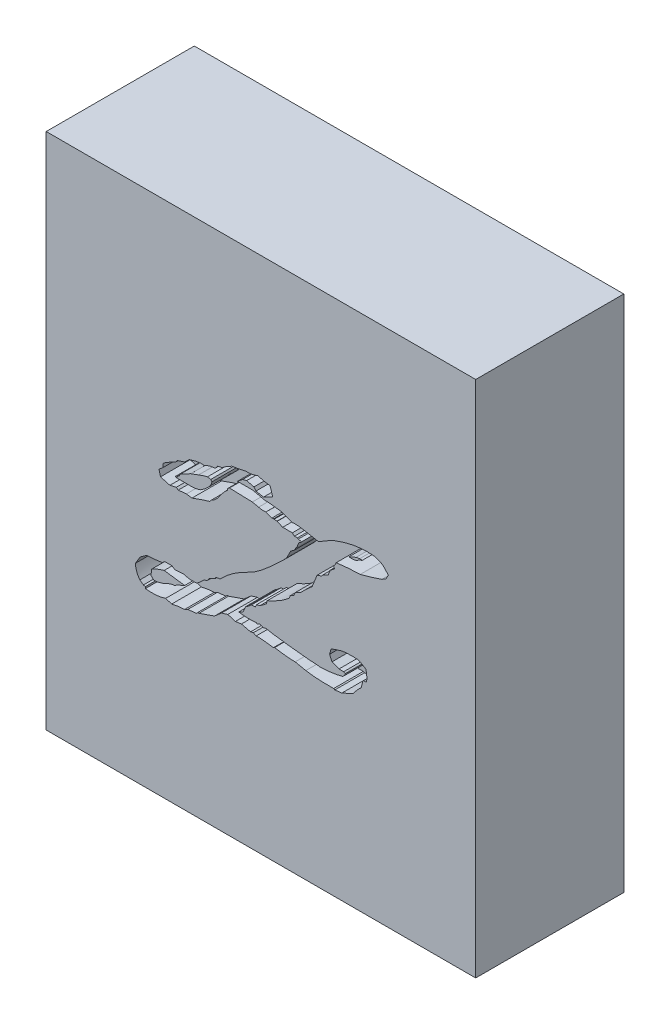
from build123d import *

# Parameters (mm, degrees)
SKETCH_1_W          = 29
SKETCH_1_H          = 35
EXTRUDE_1_DEPTH     = 10
CUT_EXTRUDE_START   = -2
CUT_EXTRUDE_1_DEPTH = 2


# Read off the part's stored shape, not the designer's step: 切除-拉伸1
with BuildPart() as part:
    # 草图1 → 凸台-拉伸1 (new body)
    with BuildSketch(Plane.XY):
        with Locations((14.5, 17.5)):
            Rectangle(SKETCH_1_W, SKETCH_1_H)
    extrude(amount=EXTRUDE_1_DEPTH)

    # 切除-拉伸1 outline → 切除-拉伸1 (cut)
    with BuildSketch(Plane.XY.offset(10).offset(CUT_EXTRUDE_START)):
        with BuildLine():
            add(Edge.make_bspline(
                [(22.917271104, 20.274238054), (22.869403472, 20.256124886), (22.781109189, 20.222714226), (22.702820752, 20.170084533), (22.666975403, 20.145987364)],
                knots=[0, 0, 0, 0, 0.542137381, 1, 1, 1, 1], degree=3))
            Line((22.917271104, 20.274238054), (23.107578579, 20.613481814))
            Line((23.107578579, 20.613481814), (22.702140915, 21.029262277))
            add(Edge.make_bspline(
                [(22.12708137, 21.244392466), (22.170055242, 21.235593963), (22.260707663, 21.217033717), (22.399373867, 21.169627039), (22.548723036, 21.107610593), (22.649390815, 21.056200998), (22.702140915, 21.029262277)],
                knots=[0, 0, 0, 0, 0.213330105, 0.450015082, 0.711806898, 1, 1, 1, 1], degree=3))
            add(Edge.make_bspline(
                [(21.696820991, 21.267146621), (21.768576367, 21.265935383), (21.912269177, 21.263509835), (22.05541685, 21.250770303), (22.12708137, 21.244392466)],
                knots=[0, 0, 0, 0, 0.499366504, 1, 1, 1, 1], degree=3))
            add(Edge.make_bspline(
                [(19.429679764, 20.793446492), (19.528573612, 20.831808457), (19.724062095, 20.907640498), (20.020061022, 21.00023724), (20.309550791, 21.085259447), (20.595732612, 21.150775708), (20.87728553, 21.202774088), (21.154002168, 21.240707471), (21.426908613, 21.261218535), (21.607153453, 21.265177252), (21.696820991, 21.267146621)],
                knots=[0, 0, 0, 0, 0.136558731, 0.269942569, 0.399229155, 0.525016684, 0.647800419, 0.767853589, 0.88451266, 1, 1, 1, 1], degree=3))
            add(Edge.make_bspline(
                [(19.102847361, 20.63003029), (19.151530386, 20.650560494), (19.263956265, 20.69797181), (19.369716292, 20.758901039), (19.429679764, 20.793446492)],
                knots=[0, 0, 0, 0, 0.433023297, 1, 1, 1, 1], degree=3))
            Line((19.102847361, 20.63003029), (18.38505721, 20.20804415))
            add(Edge.make_bspline(
                [(17.667267059, 20.344569078), (17.753995463, 20.325168911), (17.909232098, 20.290444225), (18.116416394, 20.254481651), (18.267745348, 20.221032582), (18.35188632, 20.211716735), (18.38505721, 20.20804415)],
                knots=[0, 0, 0, 0, 0.364678631, 0.65274444, 0.863101464, 1, 1, 1, 1], degree=3))
            add(Edge.make_bspline(
                [(16.819157658, 20.456271291), (16.877819297, 20.455059372), (17.003051108, 20.452472146), (17.203217012, 20.429484747), (17.427605186, 20.394849699), (17.584666673, 20.361898487), (17.667267059, 20.344569078)],
                knots=[0, 0, 0, 0, 0.205309663, 0.438298374, 0.704594855, 1, 1, 1, 1], degree=3))
            add(Edge.make_bspline(
                [(16.630918742, 20.441791375), (16.655697364, 20.445743476), (16.717997069, 20.455680057), (16.781132964, 20.456049055), (16.819157658, 20.456271291)],
                knots=[0, 0, 0, 0, 0.397732566, 1, 1, 1, 1], degree=3))
            add(Edge.make_bspline(
                [(15.863483163, 20.71690979), (15.878682961, 20.712878269), (15.914122344, 20.703478498), (15.974007159, 20.684418562), (16.048467738, 20.659561413), (16.137401009, 20.628458691), (16.24073269, 20.590963753), (16.358621798, 20.548562002), (16.488999799, 20.494799889), (16.581850777, 20.460118878), (16.630918742, 20.441791375)],
                knots=[0, 0, 0, 0, 0.057835421, 0.134847295, 0.231091253, 0.346595142, 0.48137487, 0.635440376, 0.807345066, 1, 1, 1, 1], degree=3))
            add(Edge.make_bspline(
                [(14.721638311, 20.826543444), (14.793363532, 20.822662575), (14.952801535, 20.814035789), (15.215048797, 20.793569381), (15.523820143, 20.759172027), (15.744920398, 20.731661845), (15.863483163, 20.71690979)],
                knots=[0, 0, 0, 0, 0.18780054, 0.417461844, 0.687619833, 1, 1, 1, 1], degree=3))
            add(Edge.make_bspline(
                [(13.943859934, 21.002371003), (13.99417614, 20.990567415), (14.10507327, 20.964552257), (14.285295955, 20.924309355), (14.493719464, 20.875193481), (14.642276729, 20.843483438), (14.721638311, 20.826543444)],
                knots=[0, 0, 0, 0, 0.194434276, 0.428533968, 0.69471403, 1, 1, 1, 1], degree=3))
            Line((13.943859934, 21.002371003), (12.913717297, 21.002371003))
            Line((12.913717297, 21.002371003), (13.265372414, 21.283695097))
            Line((13.265372414, 21.283695097), (13.532216591, 21.351957561))
            Line((13.532216591, 21.351957561), (14.026602315, 21.231981109))
            Line((14.026602315, 21.231981109), (14.161058683, 21.054084991))
            Line((14.161058683, 21.054084991), (14.669924324, 20.954794134))
            Line((14.669924324, 20.954794134), (15.296697856, 21.279557978))
            Line((15.296697856, 21.279557978), (15.114664619, 21.844274725))
            add(Edge.make_bspline(
                [(14.289309373, 22.013896605), (14.349167657, 21.996859839), (14.473702387, 21.961414969), (14.670994428, 21.915923423), (14.886538598, 21.877208344), (15.036677506, 21.855533405), (15.114664619, 21.844274725)],
                knots=[0, 0, 0, 0, 0.221332121, 0.460479885, 0.719755413, 1, 1, 1, 1], degree=3))
            add(Edge.make_bspline(
                [(13.503256758, 21.881508796), (13.559109968, 21.877922268), (13.677974781, 21.870289547), (13.866829264, 21.890936901), (14.073324595, 21.940739803), (14.214517217, 21.988563547), (14.289309373, 22.013896605)],
                knots=[0, 0, 0, 0, 0.208574048, 0.443879866, 0.705413618, 1, 1, 1, 1], degree=3))
            add(Edge.make_bspline(
                [(12.541376584, 21.699475559), (12.607668299, 21.707074534), (12.750448801, 21.723441368), (12.977051793, 21.764724851), (13.231898549, 21.81557373), (13.409632357, 21.858759784), (13.503256758, 21.881508796)],
                knots=[0, 0, 0, 0, 0.204278077, 0.439978457, 0.704998827, 1, 1, 1, 1], degree=3))
            add(Edge.make_bspline(
                [(11.852546266, 21.273352299), (11.961199944, 21.351895517), (12.180570008, 21.510473038), (12.420356166, 21.636081026), (12.541376584, 21.699475559)],
                knots=[0, 0, 0, 0, 0.495298563, 1, 1, 1, 1], degree=3))
            Line((11.852546266, 21.273352299), (11.583633529, 21.219569752))
            Line((11.583633529, 21.219569752), (11.397463173, 21.002371003))
            add(Edge.make_bspline(
                [(10.6858787, 20.809994968), (10.743820087, 20.83977569), (10.856902728, 20.897897921), (11.035714747, 20.958427423), (11.216032743, 20.994492171), (11.33731712, 20.999759089), (11.397463173, 21.002371003)],
                knots=[0, 0, 0, 0, 0.262118208, 0.511569038, 0.757782535, 1, 1, 1, 1], degree=3))
            add(Edge.make_bspline(
                [(9.66607886, 20.644510207), (9.769080306, 20.6770908), (9.960970882, 20.73778809), (10.235043739, 20.799958245), (10.47395976, 20.827337658), (10.61969034, 20.815411587), (10.6858787, 20.809994968)],
                knots=[0, 0, 0, 0, 0.311089015, 0.579555457, 0.80904121, 1, 1, 1, 1], degree=3))
            add(Edge.make_bspline(
                [(9.337177898, 20.342500518), (9.354328412, 20.35982698), (9.394813714, 20.40072762), (9.467022728, 20.468588379), (9.560752922, 20.550544651), (9.628905, 20.611345893), (9.66607886, 20.644510207)],
                knots=[0, 0, 0, 0, 0.163745096, 0.386534727, 0.665382579, 1, 1, 1, 1], degree=3))
            Line((9.337177898, 20.342500518), (8.85727209, 20.187358555))
            Line((8.85727209, 20.187358555), (8.726952841, 20.032216591))
            add(Edge.make_bspline(
                [(7.88298056, 19.533693748), (7.927142946, 19.569764822), (8.027798507, 19.651978545), (8.216181999, 19.767675708), (8.452467492, 19.89958284), (8.630577489, 19.985647168), (8.726952841, 20.032216591)],
                knots=[0, 0, 0, 0, 0.173899095, 0.396353376, 0.673366702, 1, 1, 1, 1], degree=3))
            Line((7.88298056, 19.533693748), (7.88298056, 19.285466607))
            Line((7.88298056, 19.285466607), (7.618204942, 19.066199298))
            Line((7.618204942, 19.066199298), (7.715427239, 18.662830193))
            Line((7.715427239, 18.662830193), (8.352543569, 18.487002634))
            Line((8.352543569, 18.487002634), (8.780735388, 18.584224932))
            Line((8.780735388, 18.584224932), (8.913123197, 18.487002634))
            Line((8.913123197, 18.487002634), (9.467497147, 18.542853741))
            Line((9.467497147, 18.542853741), (9.843974978, 18.487002634))
            add(Edge.make_bspline(
                [(11.054082294, 18.892440299), (10.970450883, 18.868957659), (10.790445965, 18.818414561), (10.506126906, 18.722828031), (10.185022742, 18.615065044), (9.961622542, 18.531178941), (9.843974978, 18.487002634)],
                knots=[0, 0, 0, 0, 0.20409704, 0.439290338, 0.704717698, 1, 1, 1, 1], degree=3))
            Line((11.054082294, 18.892440299), (11.140961793, 19.012416751))
            add(Edge.make_bspline(
                [(11.711884219, 19.52748807), (11.667165904, 19.466928085), (11.582129784, 19.351767527), (11.438319811, 19.207400159), (11.295040783, 19.090184137), (11.190961022, 19.037652569), (11.140961793, 19.012416751)],
                knots=[0, 0, 0, 0, 0.289993781, 0.551450695, 0.784519882, 1, 1, 1, 1], degree=3))
            add(Edge.make_bspline(
                [(12.251778252, 20.148055924), (12.213090865, 20.117176182), (12.125935439, 20.047609914), (11.999219045, 19.909481997), (11.856984623, 19.734027834), (11.762728258, 19.599860823), (11.711884219, 19.52748807)],
                knots=[0, 0, 0, 0, 0.179596998, 0.40459835, 0.678826736, 1, 1, 1, 1], degree=3))
            Line((12.251778252, 20.148055924), (12.251778252, 20.24941534))
            Line((12.251778252, 20.24941534), (12.371754704, 20.340431959))
            add(Edge.make_bspline(
                [(13.914900101, 20.29285509), (13.814913129, 20.295403067), (13.59629391, 20.300974162), (13.239217625, 20.31500132), (12.824754019, 20.32615412), (12.528961184, 20.335477053), (12.371754704, 20.340431959)],
                knots=[0, 0, 0, 0, 0.194350976, 0.424943948, 0.694372118, 1, 1, 1, 1], degree=3))
            add(Edge.make_bspline(
                [(14.338954801, 20.201838471), (14.28442406, 20.21398659), (14.188427796, 20.235372216), (14.064365759, 20.266349103), (13.977102748, 20.28266066), (13.931455579, 20.290141802), (13.914900101, 20.29285509)],
                knots=[0, 0, 0, 0, 0.386342293, 0.680119427, 0.883984573, 1, 1, 1, 1], degree=3))
            add(Edge.make_bspline(
                [(14.833340525, 20.168741519), (14.79755083, 20.163565847), (14.722099075, 20.152654508), (14.60262321, 20.157250827), (14.472975814, 20.170820556), (14.384985385, 20.191185121), (14.338954801, 20.201838471)],
                knots=[0, 0, 0, 0, 0.217023969, 0.457529438, 0.716216449, 1, 1, 1, 1], degree=3))
            Line((14.833340525, 20.168741519), (14.833340525, 20.1646044))
            Line((14.833340525, 20.1646044), (15.23670963, 20.013599555))
            Line((15.23670963, 20.013599555), (15.381508796, 20.059107865))
            Line((15.381508796, 20.059107865), (15.381508796, 20.013599555))
            Line((15.381508796, 20.013599555), (15.586296188, 20.013599555))
            Line((15.586296188, 20.013599555), (15.586296188, 19.99291396))
            Line((15.586296188, 19.99291396), (15.968979698, 19.841909116))
            Line((15.968979698, 19.841909116), (16.618507385, 19.841909116))
            Line((16.618507385, 19.841909116), (16.765375111, 19.717795545))
            Line((16.765375111, 19.717795545), (16.961888265, 19.717795545))
            Line((16.961888265, 19.717795545), (17.02394505, 19.680561474))
            Line((17.02394505, 19.680561474), (17.24507338, 19.627911869))
            add(Edge.make_bspline(
                [(17.042562086, 19.467499844), (17.087293918, 19.496971692), (17.159624743, 19.544627311), (17.221820541, 19.604492381), (17.24507338, 19.627911869)],
                knots=[0, 0, 0, 0, 0.522599733, 0.84503737, 0.84503737, 0.84503737, 0.84503737], degree=3))
            Line((17.042562086, 19.467499844), (16.910174277, 19.107570489))
            Line((16.910174277, 19.107570489), (16.866734527, 19.107570489))
            Line((16.866734527, 19.107570489), (16.76951223, 18.911057335))
            Line((16.76951223, 18.911057335), (16.510942291, 18.7186813))
            add(Edge.make_bspline(
                [(16.242029554, 18.205678541), (16.257042868, 18.236097654), (16.29171424, 18.306346794), (16.353615103, 18.421200062), (16.4263076, 18.56279613), (16.481060114, 18.663642543), (16.510942291, 18.7186813)],
                knots=[0, 0, 0, 0, 0.17567773, 0.405705753, 0.675653152, 1, 1, 1, 1], degree=3))
            add(Edge.make_bspline(
                [(14.007985279, 16.236409884), (14.042054146, 16.257363549), (14.115739281, 16.302682746), (14.228830487, 16.385785027), (14.359654038, 16.479110978), (14.502195159, 16.592951209), (14.661411849, 16.719604154), (14.832261225, 16.86559887), (15.019217913, 17.02464877), (15.214296977, 17.195753922), (15.405926461, 17.368280503), (15.585421, 17.529290767), (15.742318631, 17.678666993), (15.880132017, 17.813228777), (16.000988411, 17.929614032), (16.099246062, 18.034237457), (16.177389719, 18.124404736), (16.222187015, 18.180729859), (16.242029554, 18.205678541)],
                knots=[0, 0, 0, 0, 0.040175908, 0.086893621, 0.1409438, 0.201654134, 0.270152593, 0.345385065, 0.427454267, 0.516818802, 0.606124221, 0.686571581, 0.759110675, 0.823791511, 0.880137903, 0.927685787, 0.967969102, 1, 1, 1, 1], degree=3))
            add(Edge.make_bspline(
                [(13.161944438, 15.802012386), (13.21656604, 15.827912244), (13.336951167, 15.884995114), (13.530953709, 15.985901301), (13.759205064, 16.103133094), (13.921246551, 16.189942124), (14.007985279, 16.236409884)],
                knots=[0, 0, 0, 0, 0.190654024, 0.42019839, 0.689639639, 1, 1, 1, 1], degree=3))
            add(Edge.make_bspline(
                [(11.75118685, 14.711881522), (11.853621206, 14.815737842), (12.059583921, 15.024559668), (12.401652944, 15.306978493), (12.768380598, 15.569721682), (13.029698131, 15.723957482), (13.161944438, 15.802012386)],
                knots=[0, 0, 0, 0, 0.244431878, 0.491474294, 0.742647781, 1, 1, 1, 1], degree=3))
            Line((11.75118685, 14.711881522), (11.459519958, 14.653961856))
            Line((11.459519958, 14.653961856), (11.395394614, 14.546396761))
            Line((11.395394614, 14.546396761), (11.049945175, 14.401597595))
            Line((11.049945175, 14.401597595), (10.851363462, 14.159576132))
            Line((10.851363462, 14.159576132), (10.650713189, 14.107862144))
            add(Edge.make_bspline(
                [(10.156327465, 13.667258968), (10.196042589, 13.694979947), (10.279138256, 13.75298035), (10.40057565, 13.854933085), (10.525732939, 13.974296321), (10.607720765, 14.061916336), (10.650713189, 14.107862144)],
                knots=[0, 0, 0, 0, 0.218797591, 0.457788614, 0.71567752, 1, 1, 1, 1], degree=3))
            Line((10.156327465, 13.667258968), (9.643324706, 13.667258968))
            Line((9.643324706, 13.667258968), (9.293738148, 13.760344146))
            Line((9.293738148, 13.760344146), (8.68765021, 13.721041515))
            Line((8.68765021, 13.721041515), (8.491137057, 13.853429324))
            Line((8.491137057, 13.853429324), (8.002957011, 13.853429324))
            Line((8.002957011, 13.853429324), (7.845746488, 13.712767277))
            add(Edge.make_bspline(
                [(6.780438339, 13.601065063), (6.852873527, 13.604690885), (7.008989357, 13.612505432), (7.259305147, 13.636535966), (7.542102624, 13.66939058), (7.741002097, 13.697804137), (7.845746488, 13.712767277)],
                knots=[0, 0, 0, 0, 0.20301566, 0.437549192, 0.703802294, 1, 1, 1, 1], degree=3))
            Line((6.780438339, 13.601065063), (6.341903722, 13.292849696))
            Line((6.341903722, 13.292849696), (6.029551235, 12.769504139))
            add(Edge.make_bspline(
                [(6.323286686, 11.942080334), (6.278173008, 12.005516233), (6.190021386, 12.12946927), (6.099650856, 12.336231967), (6.039874248, 12.549634523), (6.033001628, 12.696014309), (6.029551235, 12.769504139)],
                knots=[0, 0, 0, 0, 0.260706566, 0.50941771, 0.753703636, 1, 1, 1, 1], degree=3))
            Line((6.323286686, 11.942080334), (6.56323959, 11.766252775))
            Line((6.56323959, 11.766252775), (6.69149028, 11.729018704))
            Line((6.69149028, 11.729018704), (6.69149028, 11.61524793))
            add(Edge.make_bspline(
                [(8.069150916, 11.735224382), (7.969794549, 11.704920567), (7.763664849, 11.642050753), (7.430665263, 11.59897162), (7.069703521, 11.58547016), (6.821051127, 11.605047248), (6.69149028, 11.61524793)],
                knots=[0, 0, 0, 0, 0.223339491, 0.463351306, 0.720378082, 1, 1, 1, 1], degree=3))
            Line((8.069150916, 11.735224382), (8.470451461, 11.602836573))
            add(Edge.make_bspline(
                [(9.347520695, 11.726950144), (9.262661266, 11.720612565), (9.100268508, 11.708484543), (8.868886189, 11.682389735), (8.661003373, 11.64776298), (8.531683096, 11.61727315), (8.470451461, 11.602836573)],
                knots=[0, 0, 0, 0, 0.287785405, 0.550725669, 0.787273873, 1, 1, 1, 1], degree=3))
            Line((9.347520695, 11.726950144), (9.558513766, 11.832446679))
            Line((9.558513766, 11.832446679), (10.164601703, 11.898640584))
            Line((10.164601703, 11.898640584), (10.224589929, 11.983451524))
            Line((10.224589929, 11.983451524), (10.313537988, 11.983451524))
            Line((10.313537988, 11.983451524), (11.364366221, 12.347517998))
            Line((11.364366221, 12.347517998), (11.83599779, 12.761229901))
            Line((11.83599779, 12.761229901), (12.26005249, 12.889480591))
            Line((12.26005249, 12.889480591), (12.777192369, 12.738475746))
            Line((12.777192369, 12.738475746), (13.180561474, 12.792258294))
            Line((13.180561474, 12.792258294), (13.796992209, 12.641253449))
            Line((13.796992209, 12.641253449), (13.987299684, 12.682624639))
            Line((13.987299684, 12.682624639), (14.17347004, 12.587470902))
            add(Edge.make_bspline(
                [(15.344274725, 12.490248605), (15.219553311, 12.508139527), (14.988396268, 12.541298329), (14.668577062, 12.577733534), (14.402528078, 12.595370221), (14.243807991, 12.589896584), (14.17347004, 12.587470902)],
                knots=[0, 0, 0, 0, 0.321201665, 0.595310983, 0.820659145, 1, 1, 1, 1], degree=3))
            Line((15.344274725, 12.490248605), (15.420811427, 12.531619795))
            add(Edge.make_bspline(
                [(16.81088342, 12.393026308), (16.717068155, 12.394062653), (16.514661973, 12.396298564), (16.188794088, 12.423180044), (15.819310654, 12.469807812), (15.558616607, 12.510244568), (15.420811427, 12.531619795)],
                knots=[0, 0, 0, 0, 0.201209934, 0.434109895, 0.700865483, 1, 1, 1, 1], degree=3))
            add(Edge.make_bspline(
                [(17.528673571, 12.242021463), (17.482500361, 12.253157531), (17.381362205, 12.27755006), (17.216020797, 12.314855106), (17.022915521, 12.354153437), (16.884710492, 12.379491234), (16.81088342, 12.393026308)],
                knots=[0, 0, 0, 0, 0.194226388, 0.425434986, 0.693075911, 1, 1, 1, 1], degree=3))
            add(Edge.make_bspline(
                [(19.408994169, 12.132387809), (19.23798441, 12.131231725), (18.905524398, 12.128984184), (18.421001375, 12.144817339), (17.964554065, 12.180784904), (17.67123948, 12.221992474), (17.528673571, 12.242021463)],
                knots=[0, 0, 0, 0, 0.272041597, 0.528875973, 0.771009597, 1, 1, 1, 1], degree=3))
            Line((19.408994169, 12.132387809), (19.49173655, 12.093085178))
            Line((19.49173655, 12.093085178), (19.959231, 12.140662047))
            Line((19.959231, 12.140662047), (20.734940817, 12.500591402))
            add(Edge.make_bspline(
                [(21.266560612, 13.094267983), (21.224302812, 13.061473752), (21.133437284, 12.99095742), (21.005952415, 12.854203782), (20.870191414, 12.689589), (20.781749827, 12.566001763), (20.734940817, 12.500591402)],
                knots=[0, 0, 0, 0, 0.200227712, 0.430542923, 0.698606474, 1, 1, 1, 1], degree=3))
            Line((21.266560612, 13.094267983), (21.378262826, 13.559693873))
            Line((21.378262826, 13.559693873), (21.436182492, 13.603133623))
            Line((21.436182492, 13.603133623), (21.634764206, 13.603133623))
            add(Edge.make_bspline(
                [(21.578913099, 14.360226405), (21.594108993, 14.304665165), (21.625457389, 14.190045008), (21.646261313, 14.006402452), (21.65029931, 13.809084092), (21.640066341, 13.673424572), (21.634764206, 13.603133623)],
                knots=[0, 0, 0, 0, 0.225911891, 0.466045329, 0.723335444, 1, 1, 1, 1], degree=3))
            Line((21.578913099, 14.360226405), (21.086595934, 14.641550499))
            add(Edge.make_bspline(
                [(19.944751083, 14.600179309), (20.017003103, 14.612400751), (20.175865056, 14.63927228), (20.439593945, 14.655039327), (20.74816145, 14.656303258), (20.968708553, 14.646689349), (21.086595934, 14.641550499)],
                knots=[0, 0, 0, 0, 0.191843468, 0.421810047, 0.690944481, 1, 1, 1, 1], degree=3))
            add(Edge.make_bspline(
                [(19.23523517, 14.360226405), (19.282028196, 14.379080044), (19.383244137, 14.419861522), (19.548284692, 14.480155003), (19.738971346, 14.538454265), (19.87371396, 14.578871236), (19.944751083, 14.600179309)],
                knots=[0, 0, 0, 0, 0.201952259, 0.43683406, 0.703095504, 1, 1, 1, 1], degree=3))
            Line((19.23523517, 14.360226405), (19.135944313, 14.00029705))
            Line((19.135944313, 14.00029705), (19.299360515, 13.638299135))
            Line((19.299360515, 13.638299135), (19.768923524, 13.456265898))
            Line((19.768923524, 13.456265898), (20.087481689, 13.456265898))
            Line((20.087481689, 13.456265898), (20.178498308, 13.40248335))
            Line((20.178498308, 13.40248335), (20.195046784, 13.385934874))
            Line((20.195046784, 13.385934874), (20.180566868, 13.292849696))
            Line((20.180566868, 13.292849696), (20.006807868, 13.141844851))
            add(Edge.make_bspline(
                [(18.55261053, 12.926714662), (18.696176482, 12.936244337), (18.968720296, 12.954335353), (19.354312061, 13.003197628), (19.69721934, 13.059388583), (19.907855446, 13.115489716), (20.006807868, 13.141844851)],
                knots=[0, 0, 0, 0, 0.293001141, 0.556229717, 0.791526034, 1, 1, 1, 1], degree=3))
            add(Edge.make_bspline(
                [(17.867917331, 12.974291531), (17.910676166, 12.975626166), (18.005226172, 12.978577364), (18.16187269, 12.967774416), (18.347420682, 12.95167391), (18.480942768, 12.935432313), (18.55261053, 12.926714662)],
                knots=[0, 0, 0, 0, 0.186681575, 0.412797595, 0.684820066, 1, 1, 1, 1], degree=3))
            add(Edge.make_bspline(
                [(14.791969335, 13.367317838), (14.861533197, 13.353111787), (15.016734594, 13.321417184), (15.276289613, 13.279108307), (15.585945993, 13.233790335), (15.946136715, 13.187355784), (16.35538045, 13.134189509), (16.815022023, 13.084607017), (17.324232929, 13.026882684), (17.681000789, 12.992372161), (17.867917331, 12.974291531)],
                knots=[0, 0, 0, 0, 0.068657918, 0.153180177, 0.254275256, 0.371313506, 0.504394769, 0.653367455, 0.818393515, 1, 1, 1, 1], degree=3))
            Line((14.791969335, 13.367317838), (14.674061443, 13.31974097))
            Line((14.674061443, 13.31974097), (14.403080146, 13.40455191))
            Line((14.403080146, 13.40455191), (14.204498433, 13.31974097))
            Line((14.204498433, 13.31974097), (14.181744278, 13.367317838))
            add(Edge.make_bspline(
                [(13.002689596, 13.408952641), (13.054178119, 13.397775975), (13.202168875, 13.368367332), (13.46714714, 13.352411276), (13.808899715, 13.343510316), (14.052140379, 13.359042144), (14.181744278, 13.367317838)],
                knots=[0.072992971, 0.072992971, 0.072992971, 0.072992971, 0.19670595, 0.427617966, 0.695022441, 1, 1, 1, 1], degree=3))
            Line((13.002689596, 13.408952641), (13.286058009, 13.551419635))
            Line((13.286058009, 13.551419635), (13.478434044, 13.963062978))
            Line((13.478434044, 13.963062978), (13.552902186, 13.987885693))
            Line((13.552902186, 13.987885693), (13.865254673, 14.25266131))
            Line((13.865254673, 14.25266131), (14.119687493, 14.25266131))
            Line((14.119687493, 14.25266131), (14.208635552, 14.438831666))
            Line((14.208635552, 14.438831666), (14.423765741, 14.482271416))
            Line((14.423765741, 14.482271416), (14.85609468, 14.800829581))
            Line((14.85609468, 14.800829581), (14.924357144, 15.024234009))
            add(Edge.make_bspline(
                [(16.403377196, 15.901303243), (16.303363476, 15.82152523), (16.095618827, 15.655813413), (15.743822695, 15.43456586), (15.351757758, 15.21899711), (15.070080546, 15.090639018), (14.924357144, 15.024234009)],
                knots=[0, 0, 0, 0, 0.222344532, 0.461845505, 0.721590172, 1, 1, 1, 1], degree=3))
            Line((16.403377196, 15.901303243), (16.47163966, 16.089542158))
            Line((16.47163966, 16.089542158), (16.728141039, 16.236409884))
            Line((16.728141039, 16.236409884), (16.800540622, 16.430854478))
            Line((16.800540622, 16.430854478), (17.19356693, 16.648053227))
            add(Edge.make_bspline(
                [(17.954796831, 17.363774819), (17.901188647, 17.32023714), (17.785056238, 17.225920654), (17.608011441, 17.059013104), (17.405038081, 16.866894232), (17.266764561, 16.723801824), (17.19356693, 16.648053227)],
                knots=[0, 0, 0, 0, 0.198095335, 0.429137623, 0.697803503, 1, 1, 1, 1], degree=3))
            add(Edge.make_bspline(
                [(18.291972032, 18.199472862), (18.267888076, 18.13946472), (18.21719221, 18.013149724), (18.136084594, 17.814054099), (18.047236635, 17.595713407), (17.986415866, 17.443109413), (17.954796831, 17.363774819)],
                knots=[0, 0, 0, 0, 0.215258938, 0.453112379, 0.715688257, 1, 1, 1, 1], degree=3))
            Line((18.291972032, 18.199472862), (18.593981721, 18.298763719))
            Line((18.593981721, 18.298763719), (18.674655542, 18.406328813))
            Line((18.674655542, 18.406328813), (19.034584897, 18.567676455))
            Line((19.034584897, 18.567676455), (19.175246944, 18.933811489))
            Line((19.175246944, 18.933811489), (19.479325192, 19.161353036))
            Line((19.479325192, 19.161353036), (19.406925609, 19.275123809))
            add(Edge.make_bspline(
                [(19.57654749, 19.572996379), (19.570104128, 19.554186918), (19.555353469, 19.511126789), (19.518315528, 19.443278282), (19.468614469, 19.362521884), (19.428662194, 19.305919251), (19.406925609, 19.275123809)],
                knots=[0, 0, 0, 0, 0.173081874, 0.396232924, 0.671512214, 1, 1, 1, 1], degree=3))
            add(Edge.make_bspline(
                [(21.202435267, 19.701247069), (21.092087258, 19.699230302), (20.854652181, 19.694890837), (20.473017016, 19.671332116), (20.041480558, 19.628534147), (19.737140383, 19.592179723), (19.57654749, 19.572996379)],
                knots=[0, 0, 0, 0, 0.202879363, 0.436534176, 0.702672817, 1, 1, 1, 1], degree=3))
            add(Edge.make_bspline(
                [(22.666975403, 20.145987364), (22.573348918, 20.113141261), (22.368396919, 20.041239869), (22.030458295, 19.934194926), (21.635790895, 19.818964373), (21.352890545, 19.742116942), (21.202435267, 19.701247069)],
                knots=[0, 0, 0, 0, 0.194414343, 0.425580525, 0.69450571, 1, 1, 1, 1], degree=3))
        make_face()
        with BuildLine():
            add(Edge.make_bspline(
                [(9.299943826, 13.098405102), (9.317096544, 13.108190899), (9.334249261, 13.117976696), (9.351385324, 13.127449735)],
                knots=[0, 0, 0, 0, 0.173492069, 0.173492069, 0.173492069, 0.173492069], degree=3))
            add(Edge.make_bspline(
                [(8.954494388, 12.972222971), (9.007708968, 12.982319341), (9.129499279, 13.005426541), (9.238544434, 13.064911351), (9.299943826, 13.098405102)],
                knots=[0, 0, 0, 0, 0.436936072, 1, 1, 1, 1], degree=3))
            Line((8.954494388, 12.972222971), (8.681444532, 12.794326853))
            add(Edge.make_bspline(
                [(7.880912, 12.519208438), (7.943058763, 12.552867125), (8.066727084, 12.619845887), (8.26371811, 12.698338253), (8.468430757, 12.759885291), (8.610081619, 12.782788397), (8.681444532, 12.794326853)],
                knots=[0, 0, 0, 0, 0.24876972, 0.495036782, 0.745602355, 1, 1, 1, 1], degree=3))
            add(Edge.make_bspline(
                [(7.374114919, 12.397163427), (7.397623136, 12.399513578), (7.45762902, 12.405512457), (7.56496137, 12.431041663), (7.710713249, 12.46794077), (7.819678889, 12.500763656), (7.880912, 12.519208438)],
                knots=[0, 0, 0, 0, 0.135645261, 0.346241225, 0.632621039, 1, 1, 1, 1], degree=3))
            add(Edge.make_bspline(
                [(7.258275587, 12.411643343), (7.25001002, 12.411288079), (7.238400044, 12.410789067), (7.208722779, 12.407713405), (7.2364036, 12.403896321), (7.265196746, 12.399649646), (7.319731747, 12.396646472), (7.358491235, 12.397014911), (7.374114919, 12.397163427)],
                knots=[0, 0, 0, 0, 0.15276716, 0.214579708, 0.266395538, 0.420173297, 0.766275832, 1, 1, 1, 1], degree=3))
            Line((7.258275587, 12.411643343), (7.088653706, 12.566785307))
            add(Edge.make_bspline(
                [(7.127956337, 12.97842865), (7.121944305, 12.956464112), (7.107838326, 12.904928909), (7.097629803, 12.813156068), (7.088831861, 12.697973231), (7.088716484, 12.613013119), (7.088653706, 12.566785307)],
                knots=[0, 0, 0, 0, 0.164478333, 0.385914066, 0.665868501, 1, 1, 1, 1], degree=3))
            add(Edge.make_bspline(
                [(7.964043784, 13.316513548), (7.893167906, 13.296786876), (7.746598385, 13.255216087), (7.533473346, 13.172979175), (7.32341517, 13.084279557), (7.192267343, 13.013256333), (7.127956337, 12.97842865)],
                knots=[0.029509371, 0.029509371, 0.029509371, 0.029509371, 0.266297885, 0.519963609, 0.764604387, 1, 1, 1, 1], degree=3))
            add(Edge.make_bspline(
                [(9.351385324, 13.127449735), (9.292177898, 13.135009803), (9.16899595, 13.151382376), (8.986062366, 13.171653661), (8.809691762, 13.194918682), (8.649706487, 13.215462699), (8.507030588, 13.234520829), (8.380586718, 13.249749073), (8.271354628, 13.268238138), (8.177967502, 13.278522272), (8.101347554, 13.292925471), (8.042404182, 13.299511992), (7.996275339, 13.30802766), (7.978175607, 13.313170353), (7.965275922, 13.3161977), (7.964043784, 13.316513548)],
                knots=[0.154147618, 0.154147618, 0.154147618, 0.154147618, 0.259195025, 0.372838445, 0.478050808, 0.572276024, 0.65671771, 0.731375897, 0.796420657, 0.851512017, 0.896998532, 0.932523599, 0.958465548, 0.973475877, 0.975139046, 0.975139046, 0.975139046, 0.975139046], degree=3))
        make_face(mode=Mode.SUBTRACT)
        with BuildLine():
            add(Edge.make_bspline(
                [(10.435582999, 19.266849571), (10.489006172, 19.302208738), (10.5921073, 19.370448228), (10.735120425, 19.476587171), (10.857025915, 19.585716451), (10.964259154, 19.689565906), (11.049212778, 19.79593917), (11.116899675, 19.899989424), (11.16660027, 20.004173894), (11.184154262, 20.075969129), (11.192675781, 20.110821853)],
                knots=[0, 0, 0, 0, 0.165373349, 0.319153243, 0.45912954, 0.587501398, 0.703969763, 0.809627816, 0.907584547, 1, 1, 1, 1], degree=3))
            add(Edge.make_bspline(
                [(9.897757526, 19.146873119), (9.993786823, 19.156801434), (10.177815061, 19.175827818), (10.352196826, 19.237404653), (10.435582999, 19.266849571)],
                knots=[0, 0, 0, 0, 0.521818275, 1, 1, 1, 1], degree=3))
            add(Edge.make_bspline(
                [(9.345452136, 19.148941679), (9.42336587, 19.148732851), (9.557818773, 19.148372484), (9.728155135, 19.150279206), (9.834312946, 19.146652032), (9.883966667, 19.146825062), (9.897757526, 19.146873119)],
                knots=[0, 0, 0, 0, 0.423205734, 0.730310781, 0.92509633, 1, 1, 1, 1], degree=3))
            Line((9.345452136, 19.148941679), (8.848997852, 19.148941679))
            Line((8.848997852, 19.148941679), (8.711125894, 19.18050273))
            Line((8.711125894, 19.18050273), (8.875889126, 19.223409821))
            Line((8.875889126, 19.223409821), (8.875889126, 19.289603726))
            Line((8.875889126, 19.289603726), (8.971042864, 19.333043475))
            Line((8.971042864, 19.333043475), (9.047579566, 19.48197976))
            Line((9.047579566, 19.48197976), (9.765369717, 19.872937509))
            Line((9.765369717, 19.872937509), (9.765369717, 19.870868949))
            add(Edge.make_bspline(
                [(10.286646714, 20.061176424), (10.219171879, 20.034700777), (10.100305088, 19.988060052), (9.945539441, 19.931091293), (9.840093325, 19.89134448), (9.784742081, 19.876177304), (9.765369717, 19.870868949)],
                knots=[0, 0, 0, 0, 0.391659647, 0.689965745, 0.89149121, 1, 1, 1, 1], degree=3))
            add(Edge.make_bspline(
                [(10.886528973, 20.24941534), (10.853275629, 20.243880024), (10.7739109, 20.230669058), (10.641662919, 20.18813415), (10.474502375, 20.132550116), (10.35335545, 20.086521674), (10.286646714, 20.061176424)],
                knots=[0, 0, 0, 0, 0.160406254, 0.382836647, 0.660163173, 1, 1, 1, 1], degree=3))
            Line((10.886528973, 20.24941534), (11.116139079, 20.216318388))
            Line((11.116139079, 20.216318388), (11.192675781, 20.110821853))
        make_face(mode=Mode.SUBTRACT)
        with BuildLine():
            add(Edge.make_bspline(
                [(21.092801613, 20.493505363), (21.126493049, 20.507539149), (21.188795855, 20.533490679), (21.270551321, 20.563794289), (21.31784142, 20.582102367), (21.336180944, 20.589305061)],
                knots=[0, 0, 0, 0, 0.241027102, 0.445711627, 0.575863623, 0.575863623, 0.575863623, 0.575863623], degree=3))
            Line((21.092801613, 20.493505363), (20.97696228, 20.394214506))
            Line((20.97696228, 20.394214506), (20.761832091, 20.340431959))
            Line((20.761832091, 20.340431959), (20.428794009, 20.340431959))
            Line((20.428794009, 20.340431959), (20.929385411, 20.563836386))
            add(Edge.make_bspline(
                [(21.167269756, 20.605207576), (21.15967091, 20.604624825), (21.136011308, 20.602810385), (21.089422759, 20.592951885), (21.017479273, 20.581348067), (20.961755325, 20.570271018), (20.929385411, 20.563836386)],
                knots=[0, 0, 0, 0, 0.094590829, 0.29451595, 0.590185937, 1, 1, 1, 1], degree=3))
            add(Edge.make_bspline(
                [(21.336180944, 20.589305061), (21.314365943, 20.59195733), (21.269187721, 20.59745657), (21.212832818, 20.602506904), (21.178304374, 20.604553518), (21.167269756, 20.605207576)],
                knots=[0.51990392, 0.51990392, 0.51990392, 0.51990392, 0.706422728, 0.906178417, 1, 1, 1, 1], degree=3))
        make_face(mode=Mode.SUBTRACT)
    extrude(amount=CUT_EXTRUDE_1_DEPTH, mode=Mode.SUBTRACT)


solid = part.part
